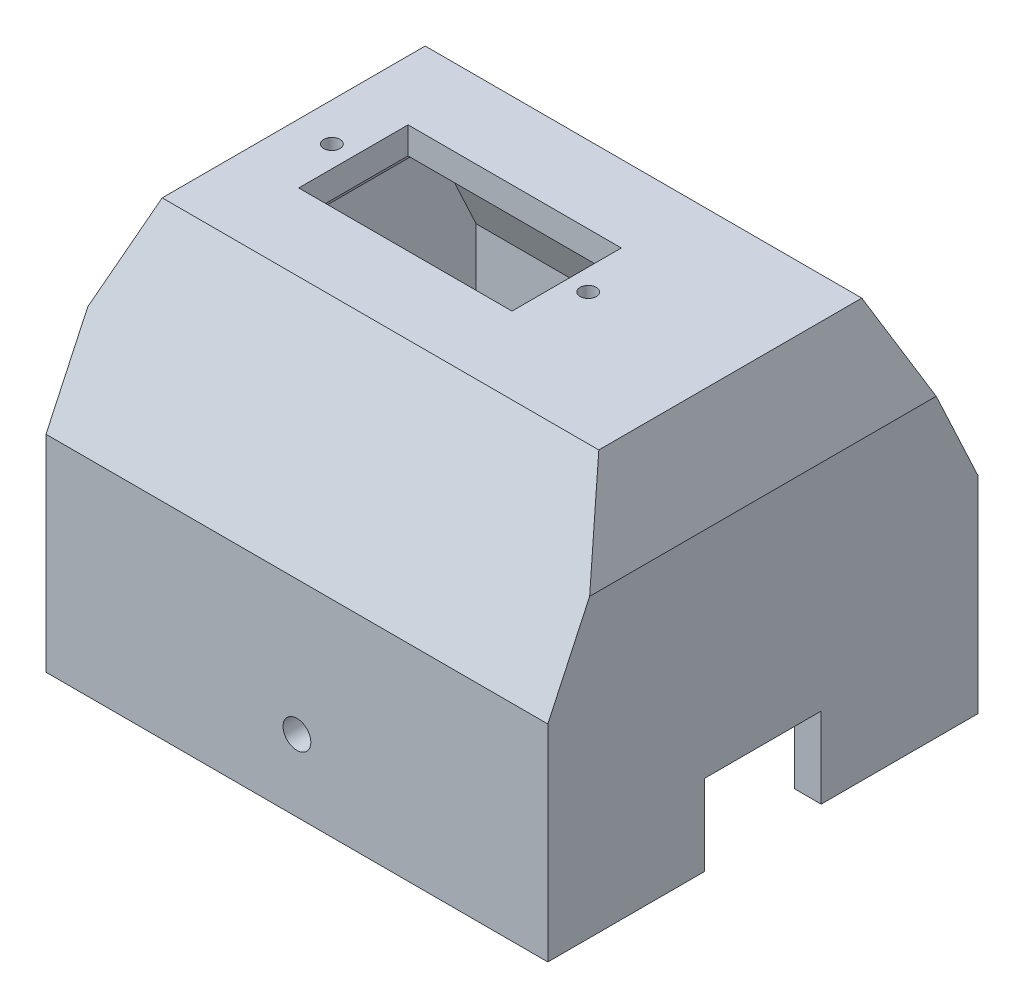
from build123d import *
from OCP.BRepFilletAPI import BRepFilletAPI_MakeChamfer

# Parameters (mm, degrees)
SKETCH_47_W         = 56
SKETCH_47_H         = 48
EXTRUDE_4_DEPTH     = 43
CHAMFER_1_SIZE      = 10
CHAMFER_1_SIZE2     = 3.639702343
CHAMFER_2_SIZE      = 20
CHAMFER_2_SIZE2     = 9.326153163
SHELL_1_T           = -3
CUT_EXTRUDE_3_REACH = 86.392
SKETCH_48_R         = 0.9
SKETCH_48_W         = 23.8
SKETCH_48_H         = 12.2
SKETCH_49_R         = 1.55
CUT_EXTRUDE_4_DEPTH = 71.263788682
CUT_EXTRUDE_5_REACH = 76.572
SKETCH_50_W         = 13
SKETCH_50_H         = 9
CUT_EXTRUDE_6_REACH = 76.572
SKETCH_51_W         = 10.719183514
SKETCH_51_H         = 21.879791556


with BuildPart() as part:
    # 草图47 → 凸台-拉伸4 (new body)
    with BuildSketch(Plane(origin=(0, 0, 0), x_dir=(1, 0, 0), z_dir=(0, 1, 0))):
        Rectangle(SKETCH_47_W, SKETCH_47_H)
    extrude(amount=EXTRUDE_4_DEPTH)

    # 倒角1: one chamfer whose edges measure the first distance from different faces: ONE call of the kernel's chamfer builder (chamfer() names one face for all edges)
    chamfer_1_edges_1 = [part.edges().sort_by_distance(p)[0] for p in [
        (28, 43, 0),
    ]]
    chamfer_1_side_1 = [part.faces().sort_by_distance(p)[0] for p in [
        (28, 21.5, 0),
    ]]
    chamfer_1_edges_2 = [part.edges().sort_by_distance(p)[0] for p in [
        (-28, 43, 0),
    ]]
    chamfer_1_side_2 = [part.faces().sort_by_distance(p)[0] for p in [
        (-28, 21.5, 0),
    ]]
    chamfer_1 = BRepFilletAPI_MakeChamfer(part.part.solid().wrapped)
    for e in chamfer_1_edges_1:
        chamfer_1.Add(CHAMFER_1_SIZE, CHAMFER_1_SIZE2, e.wrapped, chamfer_1_side_1[0].wrapped)  # the first distance lies on this face
    for e in chamfer_1_edges_2:
        chamfer_1.Add(CHAMFER_1_SIZE, CHAMFER_1_SIZE2, e.wrapped, chamfer_1_side_2[0].wrapped)  # the first distance lies on this face
    add(Compound.cast(chamfer_1.Shape()), mode=Mode.REPLACE)

    # 倒角2: one chamfer whose edges measure the first distance from different faces: ONE call of the kernel's chamfer builder (chamfer() names one face for all edges)
    chamfer_2_edges_1 = [part.edges().sort_by_distance(p)[0] for p in [
        (0, 43, -24),
    ]]
    chamfer_2_side_1 = [part.faces().sort_by_distance(p)[0] for p in [
        (0, 21.221195917, -24),
    ]]
    chamfer_2_edges_2 = [part.edges().sort_by_distance(p)[0] for p in [
        (0, 43, 24),
    ]]
    chamfer_2_side_2 = [part.faces().sort_by_distance(p)[0] for p in [
        (0, 21.221195917, 24),
    ]]
    chamfer_2 = BRepFilletAPI_MakeChamfer(part.part.solid().wrapped)
    for e in chamfer_2_edges_1:
        chamfer_2.Add(CHAMFER_2_SIZE, CHAMFER_2_SIZE2, e.wrapped, chamfer_2_side_1[0].wrapped)  # the first distance lies on this face
    for e in chamfer_2_edges_2:
        chamfer_2.Add(CHAMFER_2_SIZE, CHAMFER_2_SIZE2, e.wrapped, chamfer_2_side_2[0].wrapped)  # the first distance lies on this face
    add(Compound.cast(chamfer_2.Shape()), mode=Mode.REPLACE)

    # 抽壳1
    shell_1_openings = [part.faces().sort_by_distance(p)[0] for p in [
        (0, 0, 0),
    ]]
    offset(amount=SHELL_1_T, openings=shell_1_openings, kind=Kind.INTERSECTION)

    # 草图48 → 切除-拉伸3 (cut, up to next)
    with BuildSketch(Plane(origin=(0, 43, -43), x_dir=(1, 0, 0), z_dir=(0, -1, 0)), mode=Mode.PRIVATE) as cut_extrude_3_sk1:
        with Locations((-20.1, 43)):
            Circle(SKETCH_48_R)
    cut_extrude_3_tool1 = extrude(cut_extrude_3_sk1.sketch, amount=CUT_EXTRUDE_3_REACH, mode=Mode.PRIVATE) & part.part
    # 草图48 → 切除-拉伸3 (cut, up to next)
    with BuildSketch(Plane(origin=(0, 43, -43), x_dir=(1, 0, 0), z_dir=(0, -1, 0)), mode=Mode.PRIVATE) as cut_extrude_3_sk2:
        with Locations((8.5, 43)):
            Circle(SKETCH_48_R)
    cut_extrude_3_tool2 = extrude(cut_extrude_3_sk2.sketch, amount=CUT_EXTRUDE_3_REACH, mode=Mode.PRIVATE) & part.part
    # 草图48 → 切除-拉伸3 (cut, up to next)
    with BuildSketch(Plane(origin=(0, 43, -43), x_dir=(1, 0, 0), z_dir=(0, -1, 0)), mode=Mode.PRIVATE) as cut_extrude_3_sk3:
        with Locations((-5.8, 43)):
            Rectangle(SKETCH_48_W, SKETCH_48_H)
    cut_extrude_3_tool3 = extrude(cut_extrude_3_sk3.sketch, amount=CUT_EXTRUDE_3_REACH, mode=Mode.PRIVATE) & part.part
    add(cut_extrude_3_tool1.solids().sort_by_distance((-20.1, 43, 0))[0], mode=Mode.SUBTRACT)
    add(cut_extrude_3_tool2.solids().sort_by_distance((8.5, 43, 0))[0], mode=Mode.SUBTRACT)
    add(cut_extrude_3_tool3.solids().sort_by_distance((-5.8, 43, 0))[0], mode=Mode.SUBTRACT)

    # 草图49 → 切除-拉伸4 (cut, through all)
    with BuildSketch(Plane(origin=(0, 0, -24), x_dir=(-1, 0, 0), z_dir=(0, 0, -1))):
        with Locations((0, 8)):
            Circle(SKETCH_49_R)
    extrude(amount=-CUT_EXTRUDE_4_DEPTH, mode=Mode.SUBTRACT)

    # 草图50 → 切除-拉伸5 (cut, up to next)
    with BuildSketch(Plane(origin=(28, 0, 0), x_dir=(0, 0, -1), z_dir=(1, 0, 0)), mode=Mode.PRIVATE) as cut_extrude_5_sk1:
        with Locations((0, 4.5)):
            Rectangle(SKETCH_50_W, SKETCH_50_H)
    cut_extrude_5_tool1 = extrude(cut_extrude_5_sk1.sketch, amount=-CUT_EXTRUDE_5_REACH, mode=Mode.PRIVATE) & part.part
    add(cut_extrude_5_tool1.solids().sort_by_distance((28, 4.5, 0))[0], mode=Mode.SUBTRACT)

    # 草图51 → 切除-拉伸6 (cut, up to next)
    with BuildSketch(Plane.ZY.offset(28), mode=Mode.PRIVATE) as cut_extrude_6_sk1:
        with Locations((0, 10.939895778)):
            Rectangle(SKETCH_51_W, SKETCH_51_H)
    cut_extrude_6_tool1 = extrude(cut_extrude_6_sk1.sketch, amount=-CUT_EXTRUDE_6_REACH, mode=Mode.PRIVATE) & part.part
    add(cut_extrude_6_tool1.solids().sort_by_distance((-28, 10.939896, 0))[0], mode=Mode.SUBTRACT)


solid = part.part
